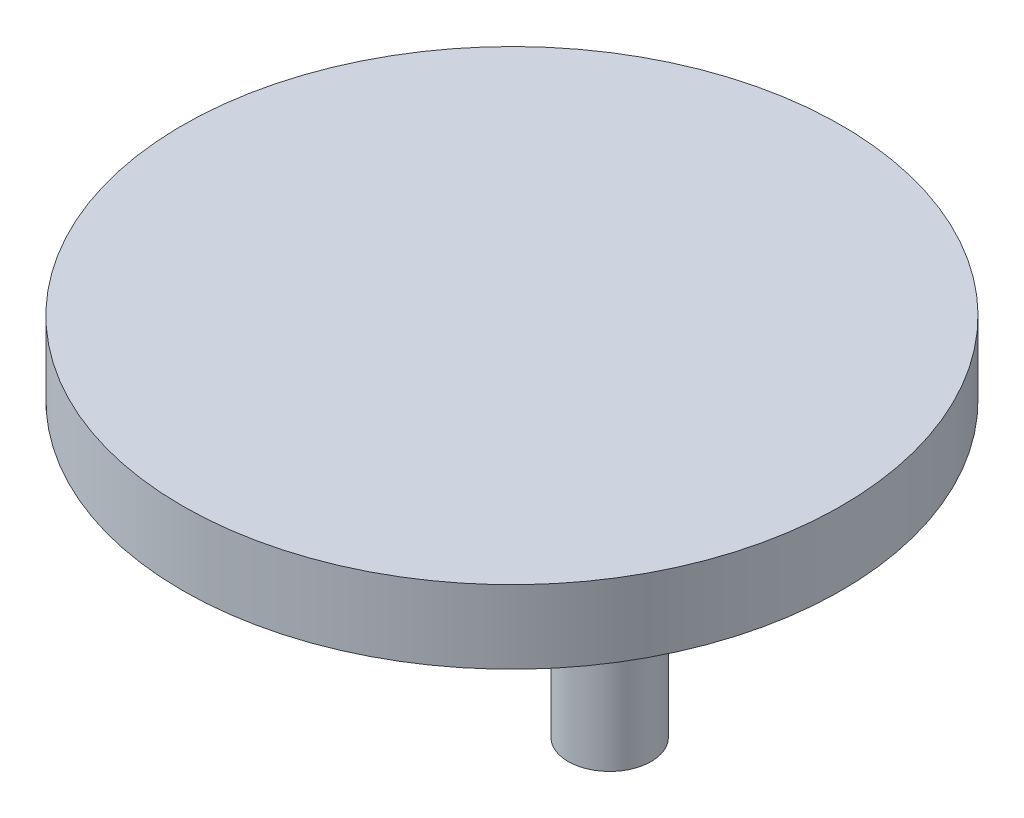
from build123d import *

# Parameters (mm, degrees)
SKETCH2_R           = 27
BOSS_EXTRUDE1_DEPTH = 6
SKETCH1_R           = 3.4
BOSS_EXTRUDE2_DEPTH = 9


with BuildPart() as part:
    # Sketch2 → Boss-Extrude1 (new body)
    with BuildSketch(Plane(origin=(0, 0, 0), x_dir=(1, 0, 0), z_dir=(0, 1, 0))):
        Circle(SKETCH2_R)
    extrude(amount=BOSS_EXTRUDE1_DEPTH)

    # Sketch1 → Boss-Extrude2 (add)
    with BuildSketch(Plane(origin=(0, 0, 0), x_dir=(1, 0, 0), z_dir=(0, 1, 0))):
        with Locations((0, 21.875)):
            Circle(SKETCH1_R)
        with Locations((18.944305708, -10.9375)):
            Circle(SKETCH1_R)
        with Locations((-18.944305708, -10.9375)):
            Circle(SKETCH1_R)
    extrude(amount=-BOSS_EXTRUDE2_DEPTH)


solid = part.part
